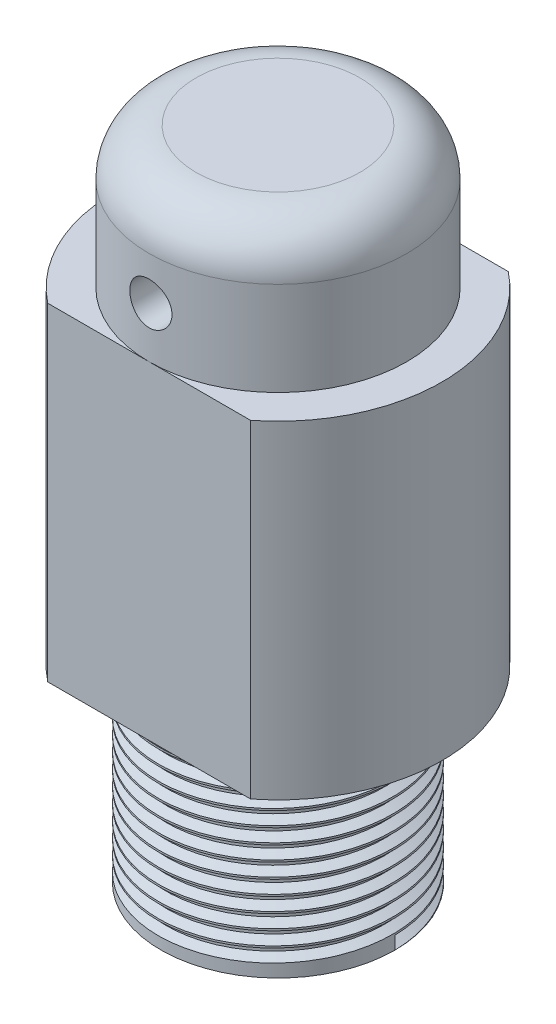
from build123d import *

# Parameters (mm, degrees)
BOSS_EXTRUDE2_DEPTH = 7
SKETCH2_R           = 2.75
BOSS_EXTRUDE4_DEPTH = 3
SKETCH3_R           = 2.5
BOSS_EXTRUDE5_DEPTH = 4
THREAD1_PITCH       = 0.3175
SKETCH10_R          = 0.5
CUT_EXTRUDE1_DEPTH  = 13
FILLET1_R           = 1
SKETCH11_R          = 0.45
CUT_EXTRUDE2_DEPTH  = 3


with BuildPart() as part:
    # Sketch1 → Boss-Extrude2 (new body)
    with BuildSketch(Plane(origin=(0, 0, 0), x_dir=(1, 0, 0), z_dir=(0, 1, 0))):
        with BuildLine():
            Line((-2.165063509, 2.75), (2.165063509, 2.75))
            ThreePointArc((2.165063509, 2.75), (3.5, 0), (2.165063509, -2.75))
            Line((2.165063509, -2.75), (-2.165063509, -2.75))
            ThreePointArc((-2.165063509, -2.75), (-3.5, 0), (-2.165063509, 2.75))
        make_face()
    extrude(amount=BOSS_EXTRUDE2_DEPTH)

    # Sketch2 → Boss-Extrude4 (add)
    with BuildSketch(Plane(origin=(0, 7, 0), x_dir=(1, 0, 0), z_dir=(0, 1, 0))):
        with Locations(Location((0, 0, 0), (0, 0, 270))):
            Circle(SKETCH2_R)
    extrude(amount=BOSS_EXTRUDE4_DEPTH)

    # Sketch3 → Boss-Extrude5 (add)
    with BuildSketch(Plane.XZ):
        with Locations(Location((0, 0, 0), (0, 0, 270))):
            Circle(SKETCH3_R)
    extrude(amount=BOSS_EXTRUDE5_DEPTH)

    # Thread1: the profile of Thread Profile1 profile screwed along a right-hand helix of 12.598425 turns, 6 arcs to a turn; built about Z, then put on its axis
    thread1_z = Axis((0, 0, 0), (0, 0, 1))
    thread1_corners = [(2.5003, 0, -0.000173205), (2.5003, 0, 0.277985704), (2.328148085, 0, 0.17859375), (2.328148085, 0, 0.09921875)]
    with BuildLine(mode=Mode.PRIVATE) as thread1_profile:
        Line(thread1_corners[0], thread1_corners[1])
        Line(thread1_corners[1], thread1_corners[2])
        Line(thread1_corners[2], thread1_corners[3])
        Line(thread1_corners[3], thread1_corners[0])
    thread1_cap = Face(thread1_profile.wire())
    thread1_turn_angles = [0, 30, 60, 90, 120, 150, 180, 210, 240, 270, 300, 330, 360]
    thread1_turn_weights = [1, 0.8660254037844387, 1, 0.8660254037844387, 1, 0.8660254037844387, 1, 0.8660254037844387, 1, 0.8660254037844387, 1, 0.8660254037844387, 1]
    thread1_turn_rails = [Edge.make_bspline([Vector(p[0], p[1], 0).rotate(thread1_z, thread1_turn_angles[k]) / thread1_turn_weights[k] + Vector(0, 0, p[2] + THREAD1_PITCH * thread1_turn_angles[k] / 360) for k in range(13)], [0, 0, 0, 1, 1, 2, 2, 3, 3, 4, 4, 5, 5, 6, 6, 6], 2, thread1_turn_weights) for p in thread1_corners]
    thread1_turn_sides = [Face.make_surface_from_curves(thread1_turn_rails[p[0]], thread1_turn_rails[p[1]]) for p in [(0, 1), (1, 2), (2, 3), (3, 0)]]
    thread1_last_angles = [4320, 4350, 4380, 4410, 4440, 4470, 4500, 4517.716535433, 4535.433070866]
    thread1_last_weights = [1, 0.8660254037844387, 1, 0.8660254037844387, 1, 0.8660254037844387, 1, 0.9525736983244454, 1]
    thread1_last_rails = [Edge.make_bspline([Vector(p[0], p[1], 0).rotate(thread1_z, thread1_last_angles[k]) / thread1_last_weights[k] + Vector(0, 0, p[2] + THREAD1_PITCH * thread1_last_angles[k] / 360) for k in range(9)], [0, 0, 0, 1, 1, 2, 2, 3, 3, 4, 4, 4], 2, thread1_last_weights) for p in thread1_corners]
    thread1_last_sides = [Face.make_surface_from_curves(thread1_last_rails[p[0]], thread1_last_rails[p[1]]) for p in [(0, 1), (1, 2), (2, 3), (3, 0)]]
    thread1 = Plane(origin=(0, -4, 0), x_dir=(1, 0, 0), z_dir=(0, 1, 0)) * Solid(Shell([*[p.moved(Location((0, 0, THREAD1_PITCH * i))) for i in range(12) for p in thread1_turn_sides], *thread1_last_sides, thread1_cap, thread1_cap.rotate(thread1_z, 4535.433070866).moved(Location((0, 0, THREAD1_PITCH * 4535.433070866 / 360)))]))
    add(thread1, mode=Mode.SUBTRACT)

    # Sketch10 → Cut-Extrude1 (cut)
    with BuildSketch(Plane.XZ.offset(4)):
        with Locations(Location((0, 0, 0), (0, 0, 270))):
            Circle(SKETCH10_R)
    extrude(amount=-CUT_EXTRUDE1_DEPTH, mode=Mode.SUBTRACT)

    # Fillet1
    fillet1_edges = [part.edges().sort_by_distance(p)[0] for p in [
        (0, 10, -2.75),
    ]]
    fillet(fillet1_edges, radius=FILLET1_R)

    # Sketch11 → Cut-Extrude2 (cut)
    with BuildSketch(Plane.XY.offset(2.75)):
        with Locations((0, 8.077826617)):
            Circle(SKETCH11_R)
    extrude(amount=-CUT_EXTRUDE2_DEPTH, mode=Mode.SUBTRACT)


solid = part.part
